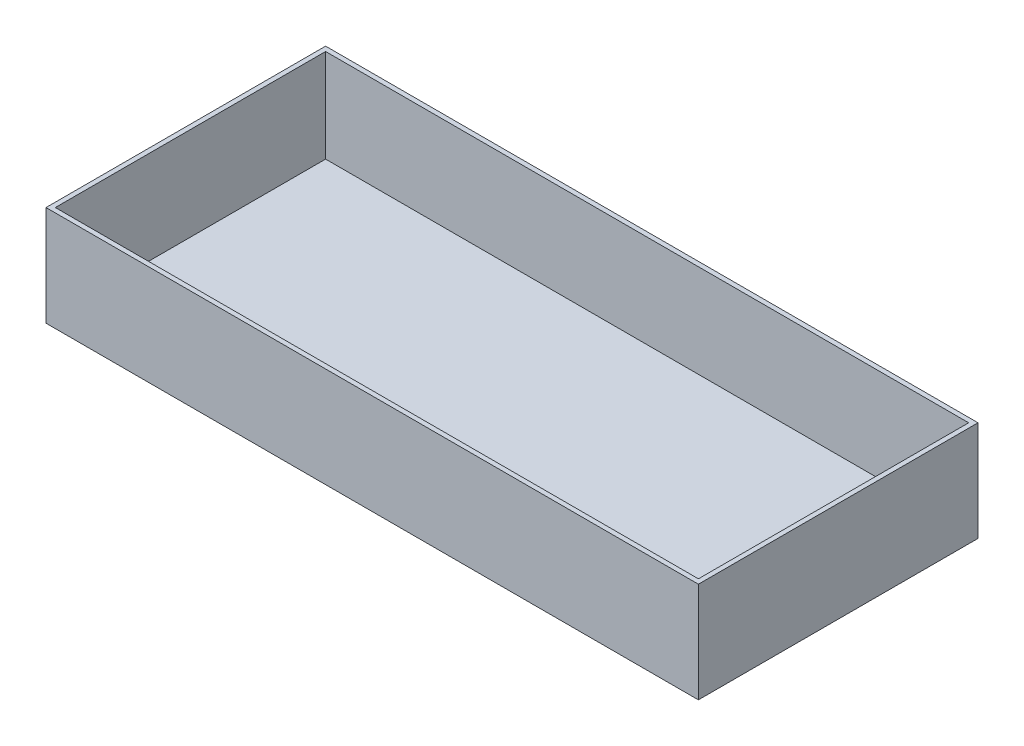
from build123d import *

# Parameters (mm, degrees)
SKETCH1_W           = 280
SKETCH1_H           = 120
BOSS_EXTRUDE1_DEPTH = 3
SKETCH2_W           = 280
SKETCH2_H           = 120
SKETCH2_W_2         = 276
SKETCH2_H_2         = 116
BOSS_EXTRUDE2_DEPTH = 40


with BuildPart() as part:
    # Sketch1 → Boss-Extrude1 (new body)
    with BuildSketch(Plane(origin=(0, 0, 0), x_dir=(1, 0, 0), z_dir=(0, 1, 0))):
        with Locations((140, -60)):
            Rectangle(SKETCH1_W, SKETCH1_H)
    extrude(amount=BOSS_EXTRUDE1_DEPTH)

    # Sketch2 → Boss-Extrude2 (add)
    with BuildSketch(Plane(origin=(0, 3, 0), x_dir=(1, 0, 0), z_dir=(0, 1, 0))):
        with Locations((140, -60)):
            Rectangle(SKETCH2_W, SKETCH2_H)
        with Locations((140, -60)):
            Rectangle(SKETCH2_W_2, SKETCH2_H_2, mode=Mode.SUBTRACT)
    extrude(amount=BOSS_EXTRUDE2_DEPTH)


solid = part.part
